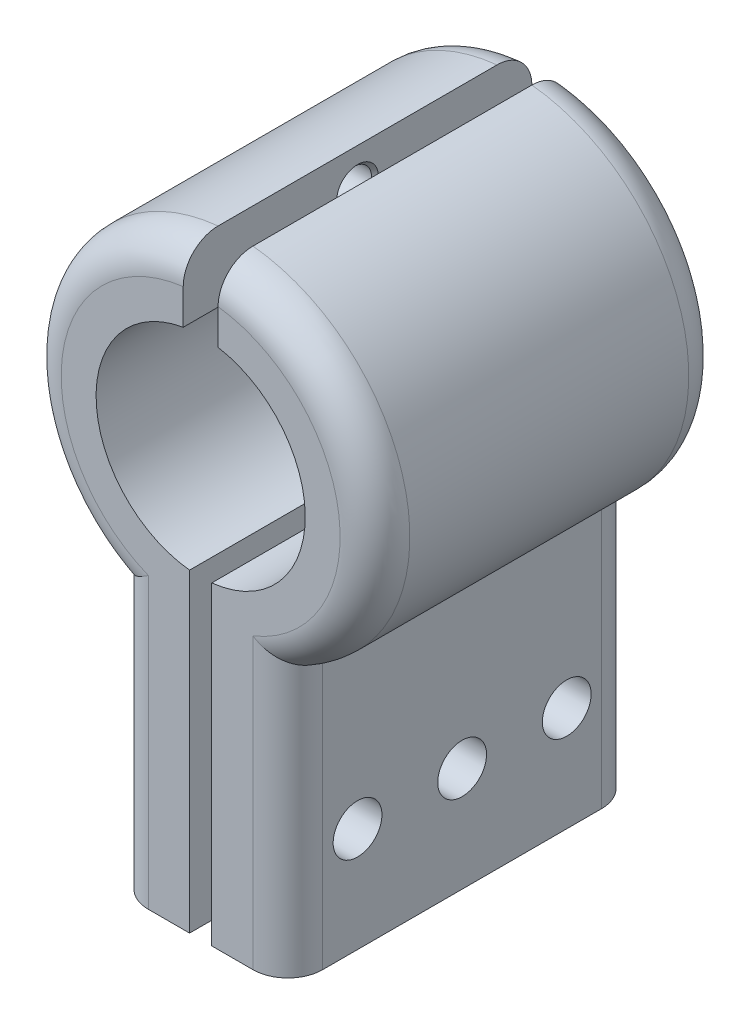
from build123d import *

# Parameters (mm, degrees)
BOSS_EXTRUDE1_DEPTH     = 25
BOSS_EXTRUDE1_2_DEPTH   = 25
FILLET1_R               = 5
FILLET2_R               = 5
CUT_EXTRUDE1_DEPTH      = 76.041655262
CUT_EXTRUDE1_DEPTH_BACK = 76.041655262
SKETCH3_R               = 3.5
SKETCH4_R               = 2.5
CUT_EXTRUDE2_DEPTH      = 8
CHAMFER1_SIZE           = 0.5
CHAMFER2_SIZE           = 0.5


with BuildPart() as part:
    # Sketch1 → Boss-Extrude1 (new, symmetric)
    with BuildSketch(Plane.XY):
        with BuildLine():
            Line((-12.5, -21.650635095), (-12.5, -60))
            Line((-12.5, -60), (-1.59, -60))
            Line((-1.59, -60), (-1.59, -14.915491946))
            ThreePointArc((-1.59, -14.915491946), (-14.992966699, -0.459292447), (-2.5, 14.790199458))
            Line((-2.5, 14.790199458), (-2.5, 24.874685928))
            ThreePointArc((-2.5, 24.874685928), (-24.441795639, 5.253439439), (-12.5, -21.650635095))
        make_face()
    extrude(amount=BOSS_EXTRUDE1_DEPTH, both=True)

    # Fillet1
    fillet1_edges = [part.edges().sort_by_distance(p)[0] for p in [
        (-24.441795639, 5.253439439, 25),
        (-24.441795639, 5.253439439, -25),
        (-12.5, -40.825317547, 25),
        (-12.5, -40.825317547, -25),
    ]]
    fillet(fillet1_edges, radius=FILLET1_R)


with BuildPart() as body_2:
    # Sketch1 → Boss-Extrude1 2 (new, symmetric)
    with BuildSketch(Plane.XY):
        with BuildLine():
            Line((12.5, -21.650635095), (12.5, -60))
            Line((12.5, -60), (1.59, -60))
            Line((1.59, -60), (1.59, -14.915491946))
            ThreePointArc((1.59, -14.915491946), (14.992966699, -0.459292447), (2.5, 14.790199458))
            Line((2.5, 14.790199458), (2.5, 24.874685928))
            ThreePointArc((2.5, 24.874685928), (24.441795639, 5.253439439), (12.5, -21.650635095))
        make_face()
    extrude(amount=BOSS_EXTRUDE1_2_DEPTH, both=True)

    # Fillet2
    fillet2_edges = [body_2.edges().sort_by_distance(p)[0] for p in [
        (24.441795639, 5.253439439, -25),
        (12.5, -40.825317547, -25),
        (12.5, -40.825317547, 25),
        (24.441795639, 5.253439439, 25),
    ]]
    fillet(fillet2_edges, radius=FILLET2_R)


with BuildPart() as cut_extrude1_tool:
    # Sketch3 → Cut-Extrude1 (new, two sides: drawn at the far end of the back side and taken through both)
    with BuildSketch(Plane.ZY.offset(12.5).offset(-CUT_EXTRUDE1_DEPTH_BACK)):
        with Locations((0, -45)):
            Circle(SKETCH3_R)
        with Locations((-15, -45)):
            Circle(SKETCH3_R)
        with Locations((15, -45)):
            Circle(SKETCH3_R)
    extrude(amount=CUT_EXTRUDE1_DEPTH + CUT_EXTRUDE1_DEPTH_BACK)


with BuildPart() as part_1:
    add(part.part)

    # Cut-Extrude1: cut by cut_extrude1_tool
    add(cut_extrude1_tool.part, mode=Mode.SUBTRACT)


with BuildPart() as body_2_1:
    add(body_2.part)

    # Cut-Extrude1: cut by cut_extrude1_tool
    add(cut_extrude1_tool.part, mode=Mode.SUBTRACT)


with BuildPart() as cut_extrude2_tool:
    # Sketch4 → Cut-Extrude2 (new, symmetric)
    with BuildSketch(Plane(origin=(0, 0, 0), x_dir=(0, 0, -1), z_dir=(1, 0, 0))):
        with Locations((0, 19.5)):
            Circle(SKETCH4_R)
    extrude(amount=CUT_EXTRUDE2_DEPTH, both=True)


with BuildPart() as part_2:
    add(part_1.part)

    # Cut-Extrude2: cut by cut_extrude2_tool
    add(cut_extrude2_tool.part, mode=Mode.SUBTRACT)

    # Chamfer1
    chamfer1_edges = [part_2.edges().sort_by_distance(p)[0] for p in [
        (-2.5, 19.5, 2.5),
        (-8, 19.5, 2.5),
    ]]
    chamfer(chamfer1_edges, length=CHAMFER1_SIZE)


with BuildPart() as body_2_2:
    add(body_2_1.part)

    # Cut-Extrude2: cut by cut_extrude2_tool
    add(cut_extrude2_tool.part, mode=Mode.SUBTRACT)

    # Chamfer2
    chamfer2_edges = [body_2_2.edges().sort_by_distance(p)[0] for p in [
        (8, 19.5, 2.5),
        (2.5, 19.5, 2.5),
    ]]
    chamfer(chamfer2_edges, length=CHAMFER2_SIZE)


solid = Compound([part_2.part, body_2_2.part])
